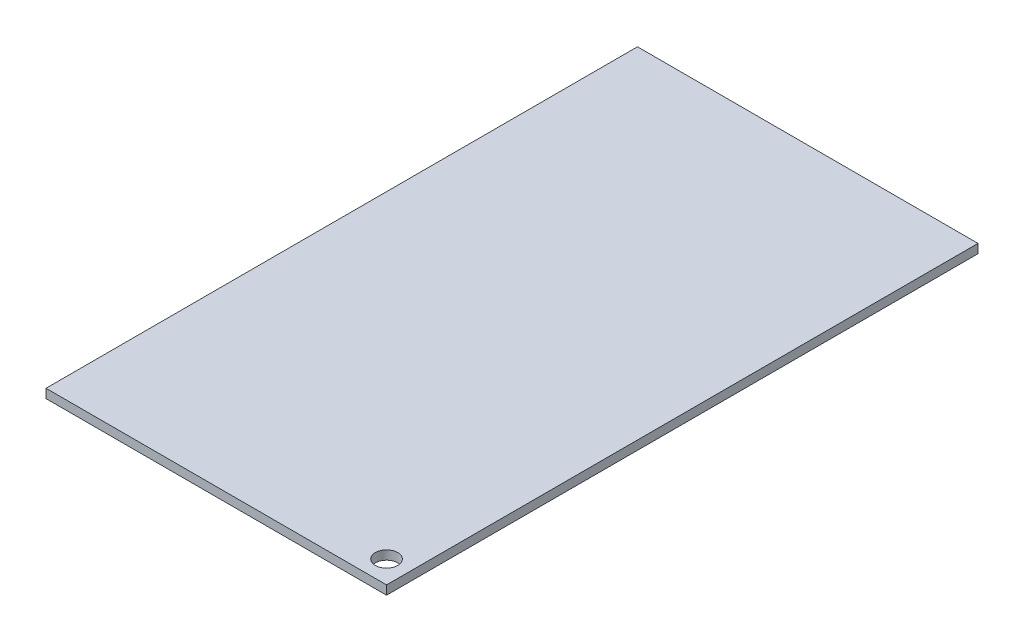
from build123d import *

# Parameters (mm, degrees)
SKETCH1_W           = 38
SKETCH1_H           = 66
BOSS_EXTRUDE1_DEPTH = 1
SKETCH2_R           = 1.25
CUT_EXTRUDE1_DEPTH  = 77.164296097


with BuildPart() as part:
    # Sketch1 → Boss-Extrude1 (new body)
    with BuildSketch(Plane(origin=(0, 0, 0), x_dir=(1, 0, 0), z_dir=(0, 1, 0))):
        with Locations((19, 33)):
            Rectangle(SKETCH1_W, SKETCH1_H)
    extrude(amount=BOSS_EXTRUDE1_DEPTH)

    # Sketch2 → Cut-Extrude1 (cut, through all)
    with BuildSketch(Plane(origin=(0, 1, 0), x_dir=(1, 0, 0), z_dir=(0, 1, 0))):
        with Locations((35.5, 2.5)):
            Circle(SKETCH2_R)
    extrude(amount=-CUT_EXTRUDE1_DEPTH, mode=Mode.SUBTRACT)


solid = part.part
